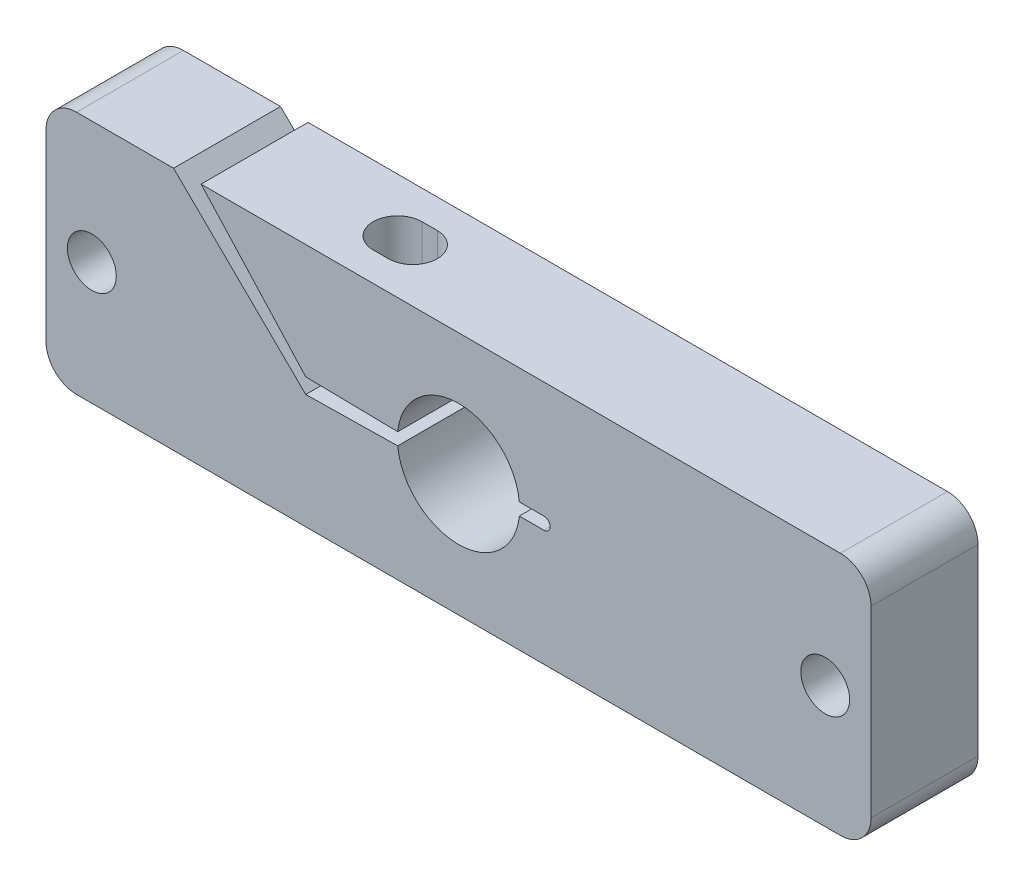
from build123d import *

# Parameters (mm, degrees)
BOSS_EXTRUDE1_DEPTH      = 3.5
BOSS_EXTRUDE1_DEPTH_BACK = 3.5
SKETCH1_R                = 1.6
CUT_EXTRUDE1_REACH       = 33.579
SKETCH3_R                = 1.6
SKETCH3_3_R              = 2.2
SKETCH3_3_R_2            = 1.6
CUT_EXTRUDE2_DEPTH       = 6
CUT_EXTRUDE3_REACH       = 33.579
FILLET1_R                = 2
FILLET2_R                = 0.4


with BuildPart() as part:
    # Sketch1 → Boss-Extrude1 (new, two sides: drawn at the far end of the back side and taken through both)
    with BuildSketch(Plane.XY.offset(-BOSS_EXTRUDE1_DEPTH_BACK)):
        with BuildLine():
            Line((-27, 8), (-18.64966284, 8))
            Line((-18.64966284, 8), (-10, -0.5))
            Line((-10, -0.5), (-3.979949748, -0.4))
            ThreePointArc((-3.979949748, -0.4), (0, -4), (3.979949748, -0.4))
            Line((3.979949748, -0.4), (6, -0.4))
            Line((6, -0.4), (6, 0.4))
            Line((6, 0.4), (3.979949748, 0.4))
            ThreePointArc((3.979949748, 0.4), (0, 4), (-3.979949748, 0.4))
            Line((-3.979949748, 0.4), (-10, 0.5))
            Line((-10, 0.5), (-16.848441102, 8))
            Line((-16.848441102, 8), (27, 8))
            Line((27, 8), (27, -8))
            Line((27, -8), (-27, -8))
            Line((-27, -8), (-27, 8))
        make_face()
        with Locations((-24, 0)):
            Circle(SKETCH1_R, mode=Mode.SUBTRACT)
        with Locations(Location((24, 0, 0), (0, 0, 180))):
            Circle(SKETCH1_R, mode=Mode.SUBTRACT)
    extrude(amount=BOSS_EXTRUDE1_DEPTH + BOSS_EXTRUDE1_DEPTH_BACK)

    # Cut-Extrude1: up to this plane
    cut_extrude1_end = Plane(origin=(-10, -0.5, -3.5), z_dir=(-0.016608865731892127, 0.9998620632762801, 0))
    # Sketch3 → Cut-Extrude1 (cut, up to the surface)
    with BuildSketch(Plane.XZ.offset(8), mode=Mode.PRIVATE) as cut_extrude1_sk1:
        with Locations(Location((-6.989974874, 0, 0), (0, 0, 270))):
            Circle(SKETCH3_R)
    cut_extrude1_tool1 = split(extrude(cut_extrude1_sk1.sketch, amount=-CUT_EXTRUDE1_REACH, mode=Mode.PRIVATE), bisect_by=cut_extrude1_end, keep=Keep.BOTH, mode=Mode.PRIVATE)
    add(cut_extrude1_tool1.solids().sort_by_distance((-6.989975, -8, 0))[0], mode=Mode.SUBTRACT)

    # Sketch3<3> → Cut-Extrude2 (cut)
    with BuildSketch(Plane.XZ.offset(8)):
        with Locations(Location((-6.989974874, 0, 0), (0, 0, 270))):
            Circle(SKETCH3_3_R)
        with Locations(Location((-6.989974874, 0, 0), (0, 0, 270))):
            Circle(SKETCH3_3_R_2, mode=Mode.SUBTRACT)
    extrude(amount=-CUT_EXTRUDE2_DEPTH, mode=Mode.SUBTRACT)

    # Cut-Extrude3: up to this plane
    cut_extrude3_end = Plane(origin=(-10, 0.5, -3.5), z_dir=(-0.016608865731892127, -0.9998620632762801, 0))
    # Sketch4 → Cut-Extrude3 (cut, up to the surface)
    with BuildSketch(Plane(origin=(0, 8, 0), x_dir=(1, 0, 0), z_dir=(0, 1, 0)), mode=Mode.PRIVATE) as cut_extrude3_sk1:
        with BuildLine():
            Line((-7.489974874, 1.6), (-6.489974874, 1.6))
            ThreePointArc((-6.489974874, 1.6), (-4.889974874, 0), (-6.489974874, -1.6))
            Line((-6.489974874, -1.6), (-7.489974874, -1.6))
            ThreePointArc((-7.489974874, -1.6), (-9.089974874, 0), (-7.489974874, 1.6))
        make_face()
    cut_extrude3_tool1 = split(extrude(cut_extrude3_sk1.sketch, amount=-CUT_EXTRUDE3_REACH, mode=Mode.PRIVATE), bisect_by=cut_extrude3_end, keep=Keep.BOTH, mode=Mode.PRIVATE)
    add(cut_extrude3_tool1.solids().sort_by_distance((-6.989975, 8, 0))[0], mode=Mode.SUBTRACT)

    # Fillet1
    fillet1_edges = [part.edges().sort_by_distance(p)[0] for p in [
        (27, 8, 0),
        (27, -8, 0),
        (-27, -8, 0),
        (-27, 8, 0),
    ]]
    fillet(fillet1_edges, radius=FILLET1_R)

    # Fillet2
    fillet2_edges = [part.edges().sort_by_distance(p)[0] for p in [
        (6, -0.4, 0),
        (6, 0.4, 0),
    ]]
    fillet(fillet2_edges, radius=FILLET2_R - 0.0001)  # a hair under: the kernel refuses the full size


solid = part.part
